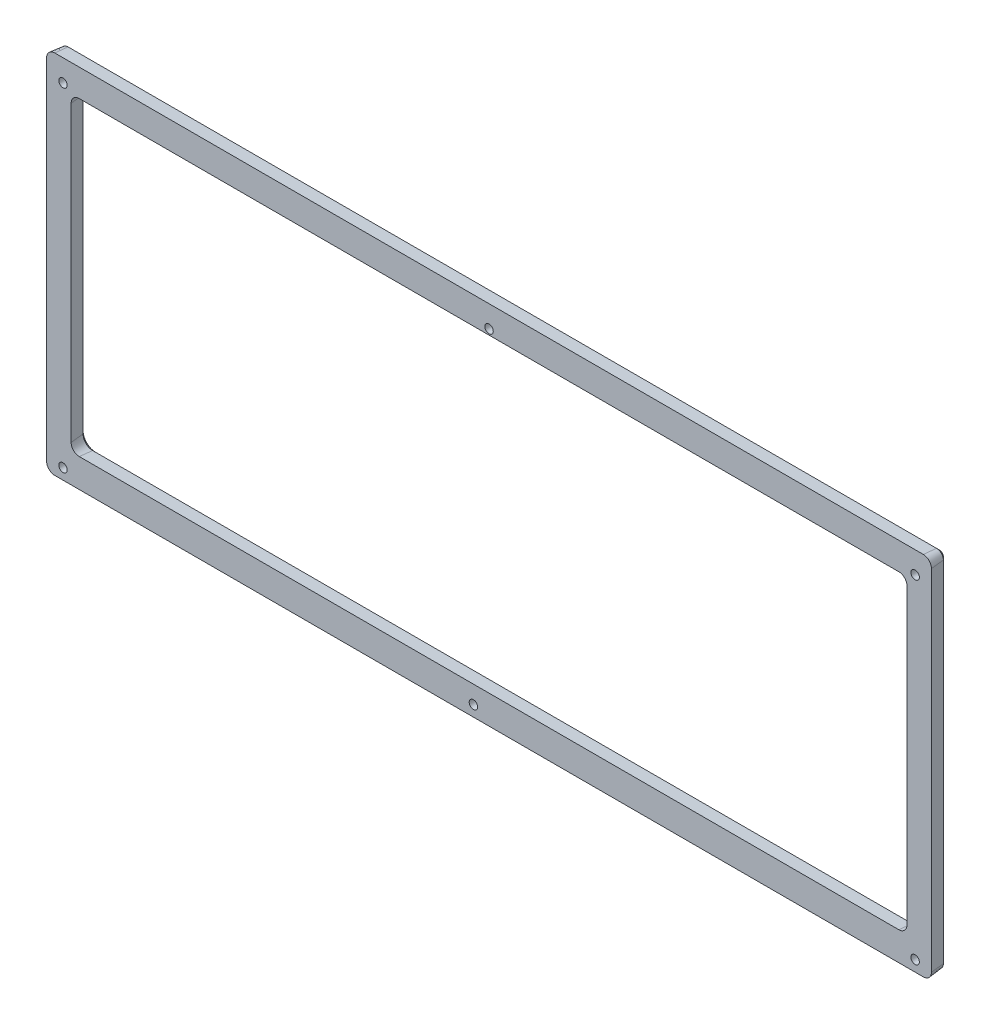
from build123d import *
from OCP.BRepFilletAPI import BRepFilletAPI_MakeChamfer

# Parameters (mm, degrees)
EXTRUDE_1_DEPTH     = 6
EXTRUDE_1_DRAFT     = -6
CHAMFER_2_SIZE      = 1.123603797
CHAMFER_2_SIZE_2    = 1
SKETCH_3_3_R        = 1.55
CUT_EXTRUDE_1_DEPTH = 3.5
CHAMFER_3_SIZE      = 1
CHAMFER_3_SIZE_2    = 1.123603797


with BuildPart() as part:
    # 草图3 → 凸台-拉伸1 (with draft: the straight prism first)
    with BuildSketch(Plane.XY):
        with BuildLine():
            Line((-9.9049154, 123.558), (-9.9049154, -4.742307))
            ThreePointArc((-9.9049154, -4.742307), (-9.026235744, -6.863627344), (-6.9049154, -7.742307))
            Line((-6.9049154, -7.742307), (311.8950846, -7.742307))
            ThreePointArc((311.8950846, -7.742307), (314.016404944, -6.863627344), (314.8950846, -4.742307))
            Line((314.8950846, -4.742307), (314.8950846, 123.558))
            ThreePointArc((314.8950846, 123.558), (314.016404944, 125.679320344), (311.8950846, 126.558))
            Line((311.8950846, 126.558), (-6.9049154, 126.558))
            ThreePointArc((-6.9049154, 126.558), (-9.026235744, 125.679320344), (-9.9049154, 123.558))
        make_face()
        with BuildLine():
            Line((2.0950846, 116.558), (302.8950846, 116.558))
            ThreePointArc((302.8950846, 116.558), (305.016404944, 115.679320344), (305.8950846, 113.558))
            Line((305.8950846, 113.558), (305.8950846, 5.757693))
            ThreePointArc((305.8950846, 5.757693), (305.016404944, 3.636372656), (302.8950846, 2.757693))
            Line((302.8950846, 2.757693), (2.0950846, 2.757693))
            ThreePointArc((2.0950846, 2.757693), (-0.026235744, 3.636372656), (-0.9049154, 5.757693))
            Line((-0.9049154, 5.757693), (-0.9049154, 113.558))
            ThreePointArc((-0.9049154, 113.558), (-0.026235744, 115.679320344), (2.0950846, 116.558))
        make_face(mode=Mode.SUBTRACT)
    extrude(amount=-EXTRUDE_1_DEPTH)
    # 凸台-拉伸1: the draft: its side faces are tilted about the plane it starts from
    extrude_1_sides = [part.faces().sort_by_distance(p)[0] for p in [
        (152.4950846, 126.558, -3),
        (-9.026235744, 125.679320344, -3),
        (-9.9049154, 59.4078465, -3),
        (-9.026235744, -6.863627344, -3),
        (152.4950846, -7.742307, -3),
        (314.016404944, -6.863627344, -3),
        (314.8950846, 59.4078465, -3),
        (314.016404944, 125.679320344, -3),
        (-0.026235744, 115.679320344, -3),
        (152.4950846, 116.558, -3),
        (305.016404944, 115.679320344, -3),
        (305.8950846, 59.6578465, -3),
        (305.016404944, 3.636372656, -3),
        (152.4950846, 2.757693, -3),
        (-0.026235744, 3.636372656, -3),
        (-0.9049154, 59.6578465, -3),
    ]]
    draft(extrude_1_sides, Plane.XY, EXTRUDE_1_DRAFT)

    # 倒角2
    chamfer_2_edges_1 = [part.edges().sort_by_distance(p)[0] for p in [
        (-0.472155248, 116.125239848, -6),
    ]]
    chamfer_2_side_1 = [part.faces().sort_by_distance(p)[0] for p in [
        (-0.470676993, 116.123761593, -5.980109562),
    ]]
    chamfer_2_edges_2 = [part.edges().sort_by_distance(p)[0] for p in [
        (152.4950846, 117.188625412, -6),
    ]]
    chamfer_2_side_2 = [part.faces().sort_by_distance(p)[0] for p in [
        (152.4950846, 117.186534842, -5.980109562),
    ]]
    chamfer_2_edges_3 = [part.edges().sort_by_distance(p)[0] for p in [
        (305.462324448, 116.125239848, -6),
    ]]
    chamfer_2_side_3 = [part.faces().sort_by_distance(p)[0] for p in [
        (305.460846193, 116.123761593, -5.980109562),
    ]]
    chamfer_2_edges_4 = [part.edges().sort_by_distance(p)[0] for p in [
        (306.525710012, 59.6578465, -6),
    ]]
    chamfer_2_side_4 = [part.faces().sort_by_distance(p)[0] for p in [
        (306.523619442, 59.6578465, -5.980109562),
    ]]
    chamfer_2_edges_5 = [part.edges().sort_by_distance(p)[0] for p in [
        (305.462324448, 3.190453152, -6),
    ]]
    chamfer_2_side_5 = [part.faces().sort_by_distance(p)[0] for p in [
        (305.460846193, 3.191931407, -5.980109562),
    ]]
    chamfer_2_edges_6 = [part.edges().sort_by_distance(p)[0] for p in [
        (152.4950846, 2.127067588, -6),
    ]]
    chamfer_2_side_6 = [part.faces().sort_by_distance(p)[0] for p in [
        (152.4950846, 2.129158158, -5.980109562),
    ]]
    chamfer_2_edges_7 = [part.edges().sort_by_distance(p)[0] for p in [
        (-0.472155248, 3.190453152, -6),
    ]]
    chamfer_2_side_7 = [part.faces().sort_by_distance(p)[0] for p in [
        (-0.470676993, 3.191931407, -5.980109562),
    ]]
    chamfer_2_edges_8 = [part.edges().sort_by_distance(p)[0] for p in [
        (-1.535540812, 59.6578465, -6),
    ]]
    chamfer_2_side_8 = [part.faces().sort_by_distance(p)[0] for p in [
        (-1.533450242, 59.6578465, -5.980109562),
    ]]
    chamfer_2 = BRepFilletAPI_MakeChamfer(part.part.solid().wrapped)
    for e in chamfer_2_edges_1:
        chamfer_2.Add(CHAMFER_2_SIZE, CHAMFER_2_SIZE_2, e.wrapped, chamfer_2_side_1[0].wrapped)
    for e in chamfer_2_edges_2:
        chamfer_2.Add(CHAMFER_2_SIZE, CHAMFER_2_SIZE_2, e.wrapped, chamfer_2_side_2[0].wrapped)
    for e in chamfer_2_edges_3:
        chamfer_2.Add(CHAMFER_2_SIZE, CHAMFER_2_SIZE_2, e.wrapped, chamfer_2_side_3[0].wrapped)
    for e in chamfer_2_edges_4:
        chamfer_2.Add(CHAMFER_2_SIZE, CHAMFER_2_SIZE_2, e.wrapped, chamfer_2_side_4[0].wrapped)
    for e in chamfer_2_edges_5:
        chamfer_2.Add(CHAMFER_2_SIZE, CHAMFER_2_SIZE_2, e.wrapped, chamfer_2_side_5[0].wrapped)
    for e in chamfer_2_edges_6:
        chamfer_2.Add(CHAMFER_2_SIZE, CHAMFER_2_SIZE_2, e.wrapped, chamfer_2_side_6[0].wrapped)
    for e in chamfer_2_edges_7:
        chamfer_2.Add(CHAMFER_2_SIZE_2, CHAMFER_2_SIZE, e.wrapped, chamfer_2_side_7[0].wrapped)
    for e in chamfer_2_edges_8:
        chamfer_2.Add(CHAMFER_2_SIZE, CHAMFER_2_SIZE_2, e.wrapped, chamfer_2_side_8[0].wrapped)
    add(Compound.cast(chamfer_2.Shape()), mode=Mode.REPLACE)

    # 草图3<3> → 切除-拉伸1 (cut)
    with BuildSketch(Plane.XY):
        with Locations((-3.9049154, -3.742307)):
            Circle(SKETCH_3_3_R)
        with Locations((-3.9049154, 118.558)):
            Circle(SKETCH_3_3_R)
        with Locations((152.4955423, 118.558)):
            Circle(SKETCH_3_3_R)
        with Locations((308.896, 118.558)):
            Circle(SKETCH_3_3_R)
        with Locations((308.896, -3.742307)):
            Circle(SKETCH_3_3_R)
        with Locations((146.756, -3.742307)):
            Circle(SKETCH_3_3_R)
    extrude(amount=-CUT_EXTRUDE_1_DEPTH, mode=Mode.SUBTRACT)

    # 倒角3
    chamfer_3_edges_1 = [part.edges().sort_by_distance(p)[0] for p in [
        (152.4950846, 125.927374588, -6),
    ]]
    chamfer_3_side_1 = [part.faces().sort_by_distance(p)[0] for p in [
        (152.4950846, 125.907374588, -6),
    ]]
    chamfer_3_edges_2 = [part.edges().sort_by_distance(p)[0] for p in [
        (-8.580316239, 125.233400839, -6),
    ]]
    chamfer_3_side_2 = [part.faces().sort_by_distance(p)[0] for p in [
        (-8.566174103, 125.219258703, -6),
    ]]
    chamfer_3_edges_3 = [part.edges().sort_by_distance(p)[0] for p in [
        (-9.274289988, 59.4078465, -6),
    ]]
    chamfer_3_side_3 = [part.faces().sort_by_distance(p)[0] for p in [
        (-9.254289988, 59.4078465, -6),
    ]]
    chamfer_3_edges_4 = [part.edges().sort_by_distance(p)[0] for p in [
        (-8.580316239, -6.417707839, -6),
    ]]
    chamfer_3_side_4 = [part.faces().sort_by_distance(p)[0] for p in [
        (-8.566174103, -6.403565703, -6),
    ]]
    chamfer_3_edges_5 = [part.edges().sort_by_distance(p)[0] for p in [
        (152.4950846, -7.111681588, -6),
    ]]
    chamfer_3_side_5 = [part.faces().sort_by_distance(p)[0] for p in [
        (152.4950846, -7.091681588, -6),
    ]]
    chamfer_3_edges_6 = [part.edges().sort_by_distance(p)[0] for p in [
        (313.570485439, -6.417707839, -6),
    ]]
    chamfer_3_side_6 = [part.faces().sort_by_distance(p)[0] for p in [
        (313.556343303, -6.403565703, -6),
    ]]
    chamfer_3_edges_7 = [part.edges().sort_by_distance(p)[0] for p in [
        (314.264459188, 59.4078465, -6),
    ]]
    chamfer_3_side_7 = [part.faces().sort_by_distance(p)[0] for p in [
        (314.244459188, 59.4078465, -6),
    ]]
    chamfer_3_edges_8 = [part.edges().sort_by_distance(p)[0] for p in [
        (313.570485439, 125.233400839, -6),
    ]]
    chamfer_3_side_8 = [part.faces().sort_by_distance(p)[0] for p in [
        (313.556343303, 125.219258703, -6),
    ]]
    chamfer_3 = BRepFilletAPI_MakeChamfer(part.part.solid().wrapped)
    for e in chamfer_3_edges_1:
        chamfer_3.Add(CHAMFER_3_SIZE, CHAMFER_3_SIZE_2, e.wrapped, chamfer_3_side_1[0].wrapped)
    for e in chamfer_3_edges_2:
        chamfer_3.Add(CHAMFER_3_SIZE_2, CHAMFER_3_SIZE, e.wrapped, chamfer_3_side_2[0].wrapped)
    for e in chamfer_3_edges_3:
        chamfer_3.Add(CHAMFER_3_SIZE, CHAMFER_3_SIZE_2, e.wrapped, chamfer_3_side_3[0].wrapped)
    for e in chamfer_3_edges_4:
        chamfer_3.Add(CHAMFER_3_SIZE, CHAMFER_3_SIZE_2, e.wrapped, chamfer_3_side_4[0].wrapped)
    for e in chamfer_3_edges_5:
        chamfer_3.Add(CHAMFER_3_SIZE, CHAMFER_3_SIZE_2, e.wrapped, chamfer_3_side_5[0].wrapped)
    for e in chamfer_3_edges_6:
        chamfer_3.Add(CHAMFER_3_SIZE, CHAMFER_3_SIZE_2, e.wrapped, chamfer_3_side_6[0].wrapped)
    for e in chamfer_3_edges_7:
        chamfer_3.Add(CHAMFER_3_SIZE, CHAMFER_3_SIZE_2, e.wrapped, chamfer_3_side_7[0].wrapped)
    for e in chamfer_3_edges_8:
        chamfer_3.Add(CHAMFER_3_SIZE, CHAMFER_3_SIZE_2, e.wrapped, chamfer_3_side_8[0].wrapped)
    add(Compound.cast(chamfer_3.Shape()), mode=Mode.REPLACE)


solid = part.part
